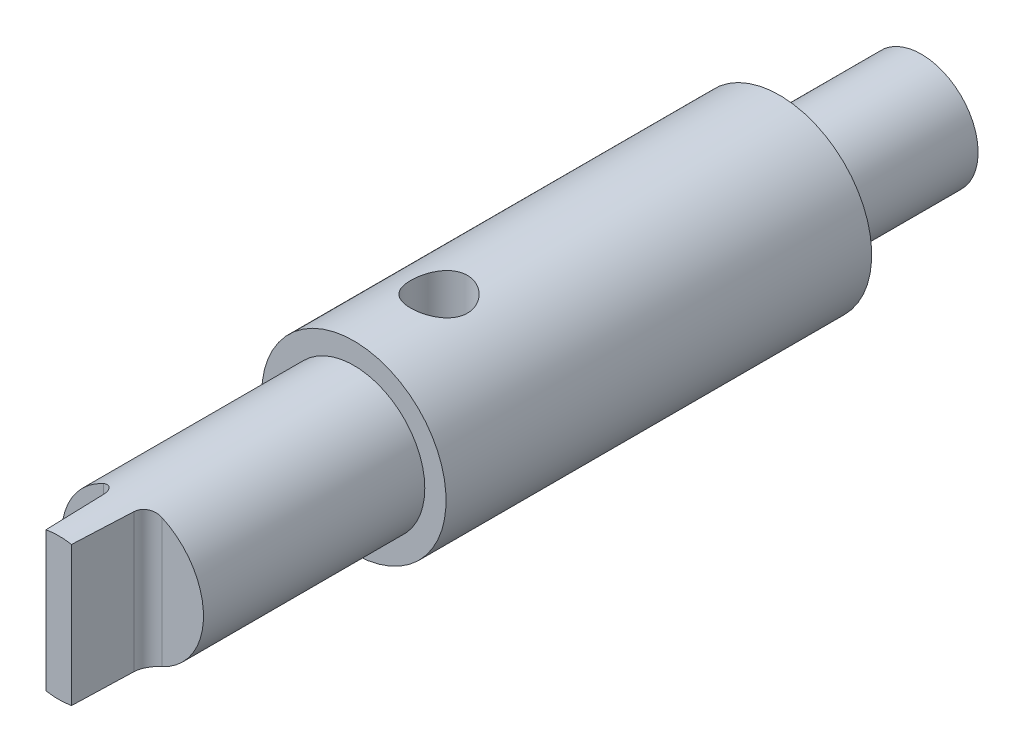
from build123d import *

# Parameters (mm, degrees)
SKETCH_1_R               = 2.5
EXTRUDE_1_DEPTH          = 10.4
SKETCH_2_R               = 3.25
EXTRUDE_2_DEPTH          = 15
CUT_EXTRUDE_1_DEPTH      = 16.68837149
CUT_EXTRUDE_1_DEPTH_BACK = 16.68837149
FILLET_1_R               = 0.5
CUT_EXTRUDE_2_DEPTH      = 16.68837149
CUT_EXTRUDE_2_DEPTH_BACK = 16.68837149
SKETCH_5_R               = 1
SKETCH_6_R               = 2
EXTRUDE_3_DEPTH          = 5


with BuildPart() as part:
    # Эскиз1 → Бобышка-Вытянуть1 (new body)
    with BuildSketch(Plane.XY):
        Circle(SKETCH_1_R)
    extrude(amount=EXTRUDE_1_DEPTH)

    # Эскиз2 → Бобышка-Вытянуть2 (add)
    with BuildSketch(Plane(origin=(0, 0, 0), x_dir=(-1, 0, 0), z_dir=(0, 0, -1))):
        Circle(SKETCH_2_R)
    extrude(amount=EXTRUDE_2_DEPTH)

    # Эскиз4 → Вырез-Вытянуть1 (cut, two sides: drawn at the far end of the back side and taken through both)
    with BuildSketch(Plane(origin=(0, 0, 0), x_dir=(1, 0, 0), z_dir=(0, 1, 0)).offset(-CUT_EXTRUDE_1_DEPTH_BACK)):
        Polygon((-0.45, -10.4), (-0.55, -7.8), (-2.5, -7.8), (-2.5, -10.4), align=None)
        Polygon((0.45, -10.4), (0.55, -7.8), (2.5, -7.8), (2.5, -10.4), align=None)
    extrude(amount=CUT_EXTRUDE_1_DEPTH + CUT_EXTRUDE_1_DEPTH_BACK, mode=Mode.SUBTRACT)

    # Скругление1
    fillet_1_edges = [part.edges().sort_by_distance(p)[0] for p in [
        (0.55, 0, 7.8),
        (-0.55, 0, 7.8),
    ]]
    fillet(fillet_1_edges, radius=FILLET_1_R)

    # Эскиз5 → Вырез-Вытянуть2 (cut, two sides: drawn at the far end of the back side and taken through both)
    with BuildSketch(Plane(origin=(0, 0, 0), x_dir=(1, 0, 0), z_dir=(0, 1, 0)).offset(-CUT_EXTRUDE_2_DEPTH_BACK)):
        with Locations((0, 3)):
            Circle(SKETCH_5_R)
    extrude(amount=CUT_EXTRUDE_2_DEPTH + CUT_EXTRUDE_2_DEPTH_BACK, mode=Mode.SUBTRACT)

    # Эскиз6 → Бобышка-Вытянуть3 (add)
    with BuildSketch(Plane(origin=(0, 0, -15), x_dir=(-1, 0, 0), z_dir=(0, 0, -1))):
        Circle(SKETCH_6_R)
    extrude(amount=EXTRUDE_3_DEPTH)


solid = part.part
